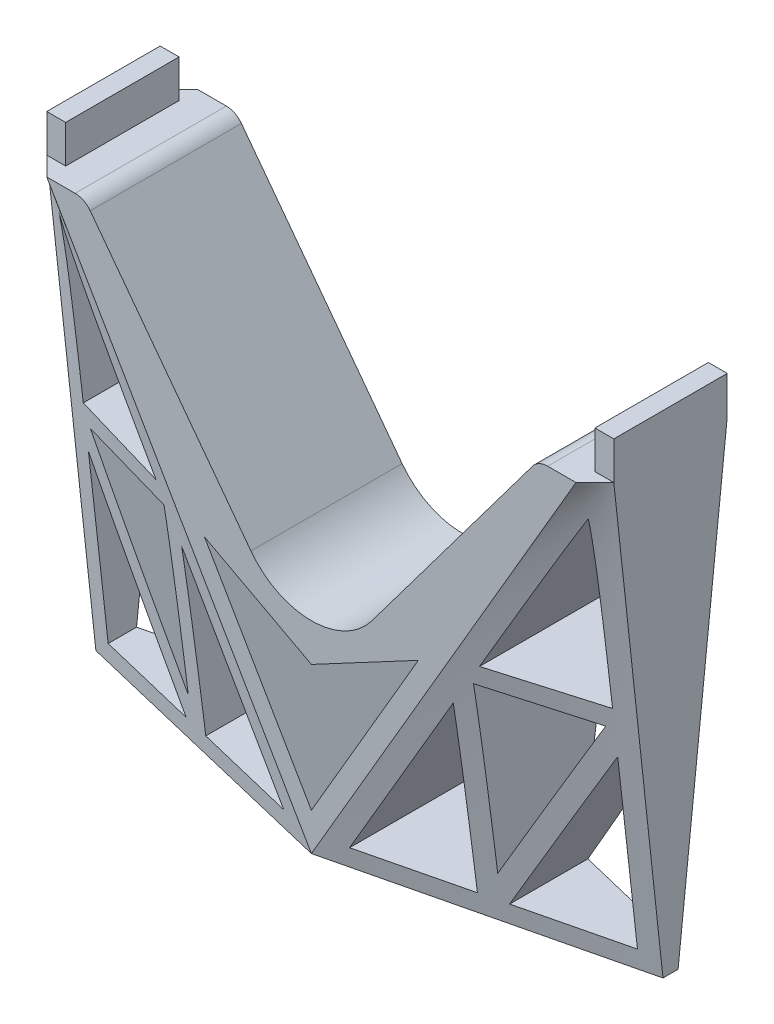
from build123d import *

# Parameters (mm, degrees)
SKETCH6_W               = 150
SKETCH6_H               = 40
BOSS_EXTRUDE1_DEPTH     = 130
CUT_EXTRUDE1_DEPTH      = 10
CUT_EXTRUDE2_DEPTH      = 152.410039297
CUT_EXTRUDE2_DEPTH_BACK = 152.410039297
FILLET1_R               = 20
FILLET2_R               = 5
CUT_EXTRUDE3_DEPTH      = 152.410039446
CUT_EXTRUDE3_DEPTH_BACK = 152.410039446


# Read off the part's stored shape, not the designer's step: Mirror2
with BuildPart() as part:
    # Sketch6 → Boss-Extrude1 (new body)
    with BuildSketch(Plane(origin=(0, 0, 0), x_dir=(1, 0, 0), z_dir=(0, 1, 0))):
        Rectangle(SKETCH6_W, SKETCH6_H)
    extrude(amount=BOSS_EXTRUDE1_DEPTH)

    # Sketch7 → Cut-Extrude1 (cut)
    with BuildSketch(Plane(origin=(0, 130, 0), x_dir=(1, 0, 0), z_dir=(0, 1, 0))):
        Polygon((-75, 20), (-75, 15), (-70, 15), (-70, -15), (-75, -15), (-75, -20), (75, -20), (75, -15), (70, -15), (70, 15), (75, 15), (75, 20), align=None)
    extrude(amount=-CUT_EXTRUDE1_DEPTH, mode=Mode.SUBTRACT)

    # Sketch8 → Cut-Extrude2 (cut, two sides: drawn at the far end of the back side and taken through both)
    with BuildSketch(Plane.XY.offset(-CUT_EXTRUDE2_DEPTH_BACK)):
        Polygon((-60, 120), (0, 40), (60, 120), align=None)
    extrude(amount=CUT_EXTRUDE2_DEPTH + CUT_EXTRUDE2_DEPTH_BACK, mode=Mode.SUBTRACT)

    # Fillet1
    fillet1_edges = [part.edges().sort_by_distance(p)[0] for p in [
        (0, 40, 0),
    ]]
    fillet(fillet1_edges, radius=FILLET1_R)

    # Fillet2
    fillet2_edges = [part.edges().sort_by_distance(p)[0] for p in [
        (-60, 120, 0),
        (60, 120, 0),
    ]]
    fillet(fillet2_edges, radius=FILLET2_R)

    # Sketch10 → Cut-Loft1 section 0
    with BuildSketch(Plane.XZ):
        with BuildLine():
            Line((75, 20), (75, 2))
            Line((75, 2), (0, 20))
            Line((0, 20), (75, 20))
        make_face()
    # Sketch9 → Cut-Loft1 section 1
    with BuildSketch(Plane(origin=(0, 120, 0), x_dir=(1, 0, 0), z_dir=(0, 1, 0))):
        with BuildLine():
            Line((75, -15), (75, -20))
            Line((75, -20), (70, -20))
            Line((70, -20), (75, -15))
        make_face()
    cut_loft1 = loft(mode=Mode.SUBTRACT)

    # Mirror1: Cut-Loft1 across plane
    add(cut_loft1.mirror(Plane.XY), mode=Mode.SUBTRACT)

    # Mirror2
    split(bisect_by=Plane(origin=(0, 0, 0), x_dir=(0, 0, 1), z_dir=(1, 0, 0)), keep=Keep.TOP)

    # Mirror2 2: part across plane


with BuildPart() as part_1:
    add(part.part)
    add(part.part.mirror(Plane(origin=(0, 0, 0), x_dir=(0, 0, 1), z_dir=(1, 0, 0))))

    # Sketch12 → Cut-Extrude3 (cut, two sides: drawn at the far end of the back side and taken through both)
    with BuildSketch(Plane.XY.offset(-CUT_EXTRUDE3_DEPTH_BACK)):
        Polygon((-70, 110.076825722), (-70, 63.412063573), (-42.778888747, 63.412063573), align=None)
        Polygon((-70, 51.664762149), (-70, 5), (-42.778888747, 5), align=None)
        Polygon((-68.147407502, 58.412063573), (-40.926296249, 11.747301425), (-40.926296249, 58.412063573), align=None)
        Polygon((-35.926296249, 51.664762149), (-35.926296249, 5), (-8.705184996, 5), align=None)
        Polygon((0, 43.333333333), (-28.285185422, 58.412063573), (0, 9.923174278), (28.285185422, 58.412063573), align=None)
        Polygon((40.926296249, 11.747301425), (40.926296249, 58.412063573), (68.147407502, 58.412063573), align=None)
        Polygon((8.705184996, 5), (35.926296249, 51.664762149), (35.926296249, 5), align=None)
        Polygon((70, 5), (42.778888747, 5), (70, 51.664762149), align=None)
        Polygon((70, 63.412063573), (42.778888747, 63.412063573), (70, 110.076825722), align=None)
    extrude(amount=CUT_EXTRUDE3_DEPTH + CUT_EXTRUDE3_DEPTH_BACK, mode=Mode.SUBTRACT)


solid = part_1.part
